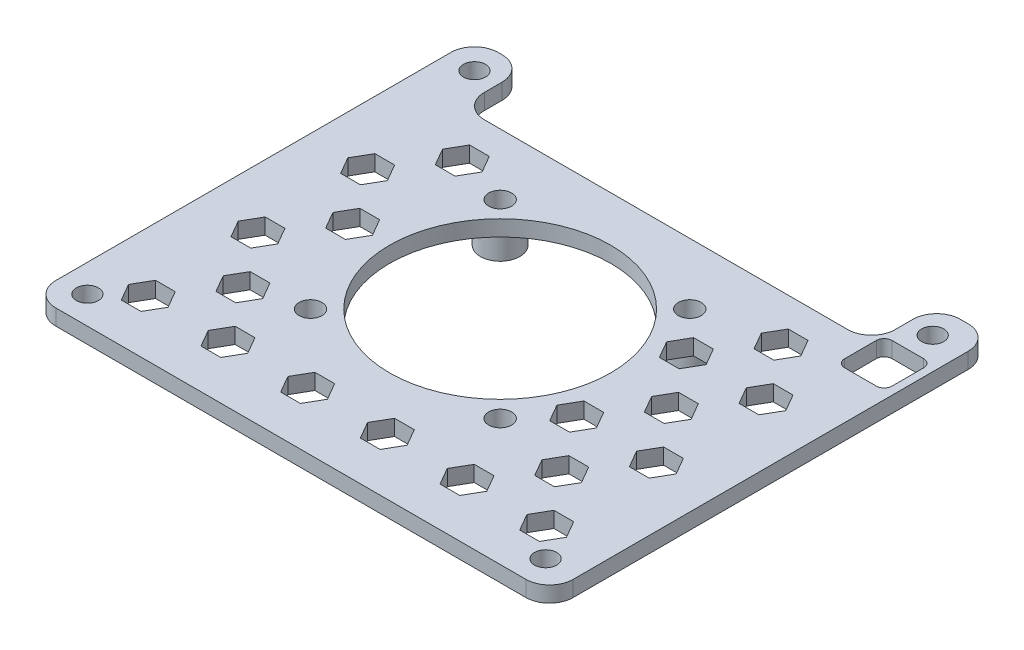
from build123d import *

# Parameters (mm, degrees)
SKETCH_1_R      = 1.4
SKETCH_1_R_2    = 14
SKETCH_1_R_3    = 2.5
EXTRUDE_1_DEPTH = 2
SKETCH_1_4_R    = 2.5
SKETCH_1_4_R_2  = 1.45
EXTRUDE_2_DEPTH = 5
OTHER_START     = -2
OTHER_1_DEPTH   = 2


# Read off the part's stored shape, not the designer's step: 填充阵列1
with BuildPart() as part:
    # 草图1 → 凸台-拉伸1 (new body)
    with BuildSketch(Plane(origin=(0, 0, 0), x_dir=(1, 0, 0), z_dir=(0, 1, 0))):
        with BuildLine():
            Line((-42.5, 25), (-42.5, -25))
            ThreePointArc((-42.5, -25), (-41.621320344, -27.121320344), (-39.5, -28))
            Line((-39.5, -28), (20, -28))
            ThreePointArc((20, -28), (22.121320344, -27.121320344), (23, -25))
            Line((23, -25), (23, 25))
            ThreePointArc((23, 25), (22.121320344, 27.121320344), (20, 28))
            Line((20, 28), (19, 28))
            ThreePointArc((19, 28), (16.878679656, 27.121320344), (16, 25))
            Line((16, 25), (16, 22.75))
            ThreePointArc((16, 22.75), (15.121320344, 20.628679656), (13, 19.75))
            Line((13, 19.75), (-33, 19.75))
            ThreePointArc((-33, 19.75), (-35.121320344, 20.628679656), (-36, 22.75))
            Line((-36, 22.75), (-36, 25))
            ThreePointArc((-36, 25), (-36.878679656, 27.121320344), (-39, 28))
            Line((-39, 28), (-39.5, 28))
            ThreePointArc((-39.5, 28), (-41.621320344, 27.121320344), (-42.5, 25))
        make_face()
        with Locations(Location((-39, 24.5, 0), (0, 0, 270))):
            Circle(SKETCH_1_R, mode=Mode.SUBTRACT)
        with Locations(Location((-39, -24.5, 0), (0, 0, 270))):
            Circle(SKETCH_1_R, mode=Mode.SUBTRACT)
        with Locations(Location((19, 24.5, 0), (0, 0, 270))):
            Circle(SKETCH_1_R, mode=Mode.SUBTRACT)
        with Locations(Location((19, -24.5, 0), (0, 0, 270))):
            Circle(SKETCH_1_R, mode=Mode.SUBTRACT)
        with Locations(Location((-11.25, 0, 0), (0, 0, 270))):
            Circle(SKETCH_1_R_2, mode=Mode.SUBTRACT)
        with Locations(Location((-23.25, 12, 0), (0, 0, 270))):
            Circle(SKETCH_1_R_3, mode=Mode.SUBTRACT)
        with Locations(Location((-23.25, -12, 0), (0, 0, 270))):
            Circle(SKETCH_1_R_3, mode=Mode.SUBTRACT)
        with Locations(Location((0.75, -12, 0), (0, 0, 270))):
            Circle(SKETCH_1_R_3, mode=Mode.SUBTRACT)
        with Locations(Location((0.75, 12, 0), (0, 0, 270))):
            Circle(SKETCH_1_R_3, mode=Mode.SUBTRACT)
        with BuildLine():
            Line((17, 15.36), (21, 15.36))
            ThreePointArc((21, 15.36), (21.707106781, 15.652893219), (22, 16.36))
            Line((22, 16.36), (22, 20.36))
            ThreePointArc((22, 20.36), (21.707106781, 21.067106781), (21, 21.36))
            Line((21, 21.36), (17, 21.36))
            ThreePointArc((17, 21.36), (16.292893219, 21.067106781), (16, 20.36))
            Line((16, 20.36), (16, 16.36))
            ThreePointArc((16, 16.36), (16.292893219, 15.652893219), (17, 15.36))
        make_face(mode=Mode.SUBTRACT)
    extrude(amount=-EXTRUDE_1_DEPTH)

    # 草图1<4> → 凸台-拉伸2 (add)
    # profile 1 of 4: a face of its own
    with BuildSketch(Plane(origin=(0, 0, 0), x_dir=(1, 0, 0), z_dir=(0, 1, 0))):
        with Locations(Location((-23.25, 12, 0), (0, 0, 270))):
            Circle(SKETCH_1_4_R)
        with Locations(Location((-23.25, 12, 0), (0, 0, 270))):
            Circle(SKETCH_1_4_R_2, mode=Mode.SUBTRACT)
    # profile 2 of 4: a face of its own
    with BuildSketch(Plane(origin=(0, 0, 0), x_dir=(1, 0, 0), z_dir=(0, 1, 0))):
        with Locations(Location((0.75, 12, 0), (0, 0, 270))):
            Circle(SKETCH_1_4_R)
        with Locations(Location((0.75, 12, 0), (0, 0, 270))):
            Circle(SKETCH_1_4_R_2, mode=Mode.SUBTRACT)
    # profile 3 of 4: a face of its own
    with BuildSketch(Plane(origin=(0, 0, 0), x_dir=(1, 0, 0), z_dir=(0, 1, 0))):
        with Locations(Location((0.75, -12, 0), (0, 0, 270))):
            Circle(SKETCH_1_4_R)
        with Locations(Location((0.75, -12, 0), (0, 0, 270))):
            Circle(SKETCH_1_4_R_2, mode=Mode.SUBTRACT)
    # profile 4 of 4: a face of its own
    with BuildSketch(Plane(origin=(0, 0, 0), x_dir=(1, 0, 0), z_dir=(0, 1, 0))):
        with Locations(Location((-23.25, -12, 0), (0, 0, 270))):
            Circle(SKETCH_1_4_R)
        with Locations(Location((-23.25, -12, 0), (0, 0, 270))):
            Circle(SKETCH_1_4_R_2, mode=Mode.SUBTRACT)
    extrude(amount=-EXTRUDE_2_DEPTH)

    # 填充阵列1 outline → 填充阵列1 (cut)
    with BuildSketch(Plane(origin=(0, 0, 0), x_dir=(1, 0, 0), z_dir=(0, 1, 0)).offset(OTHER_START)):
        Polygon((-32.464891196, 6.941064074), (-33.714891196, 9.106127583), (-36.214891196, 9.106127583), (-37.464891196, 6.941064074), (-36.214891196, 4.776000564), (-33.714891196, 4.776000564), align=None)
        Polygon((16.714891196, 9.106127583), (14.214891196, 9.106127583), (12.964891196, 6.941064074), (14.214891196, 4.776000564), (16.714891196, 4.776000564), (17.964891196, 6.941064074), align=None)
        Polygon((6.628934718, 9.106127583), (4.128934718, 9.106127583), (2.878934718, 6.941064074), (4.128934718, 4.776000564), (6.628934718, 4.776000564), (7.878934718, 6.941064074), align=None)
        Polygon((-2.207021761, -20.823192222), (-3.457021761, -18.658128712), (-5.957021761, -18.658128712), (-7.207021761, -20.823192222), (-5.957021761, -22.988255731), (-3.457021761, -22.988255731), align=None)
        Polygon((6.628934718, -18.658128712), (4.128934718, -18.658128712), (2.878934718, -20.823192222), (4.128934718, -22.988255731), (6.628934718, -22.988255731), (7.878934718, -20.823192222), align=None)
        Polygon((16.714891196, -18.658128712), (14.214891196, -18.658128712), (12.964891196, -20.823192222), (14.214891196, -22.988255731), (16.714891196, -22.988255731), (17.964891196, -20.823192222), align=None)
        Polygon((-13.542978239, -18.658128712), (-16.042978239, -18.658128712), (-17.292978239, -20.823192222), (-16.042978239, -22.988255731), (-13.542978239, -22.988255731), (-12.292978239, -20.823192222), align=None)
        Polygon((-23.628934718, -18.658128712), (-26.128934718, -18.658128712), (-27.378934718, -20.823192222), (-26.128934718, -22.988255731), (-23.628934718, -22.988255731), (-22.378934718, -20.823192222), align=None)
        Polygon((-33.714891196, -18.658128712), (-36.214891196, -18.658128712), (-37.464891196, -20.823192222), (-36.214891196, -22.988255731), (-33.714891196, -22.988255731), (-32.464891196, -20.823192222), align=None)
        Polygon((-27.421912957, 13.882128148), (-28.671912957, 16.047191657), (-31.171912957, 16.047191657), (-32.421912957, 13.882128148), (-31.171912957, 11.717064638), (-28.671912957, 11.717064638), align=None)
        Polygon((11.671912957, 16.047191657), (9.171912957, 16.047191657), (7.921912957, 13.882128148), (9.171912957, 11.717064638), (11.671912957, 11.717064638), (12.921912957, 13.882128148), align=None)
        Polygon((-32.464891196, -6.941064074), (-33.714891196, -4.776000564), (-36.214891196, -4.776000564), (-37.464891196, -6.941064074), (-36.214891196, -9.106127583), (-33.714891196, -9.106127583), align=None)
        Polygon((6.628934718, -4.776000564), (4.128934718, -4.776000564), (2.878934718, -6.941064074), (4.128934718, -9.106127583), (6.628934718, -9.106127583), (7.878934718, -6.941064074), align=None)
        Polygon((16.714891196, -4.776000564), (14.214891196, -4.776000564), (12.964891196, -6.941064074), (14.214891196, -9.106127583), (16.714891196, -9.106127583), (17.964891196, -6.941064074), align=None)
        Polygon((-27.421912957, 0), (-28.671912957, 2.165063509), (-31.171912957, 2.165063509), (-32.421912957, 0), (-31.171912957, -2.165063509), (-28.671912957, -2.165063509), align=None)
        Polygon((11.671912957, 2.165063509), (9.171912957, 2.165063509), (7.921912957, 0), (9.171912957, -2.165063509), (11.671912957, -2.165063509), (12.921912957, 0), align=None)
        Polygon((-27.421912957, -13.882128148), (-28.671912957, -11.717064638), (-31.171912957, -11.717064638), (-32.421912957, -13.882128148), (-31.171912957, -16.047191657), (-28.671912957, -16.047191657), align=None)
        Polygon((11.671912957, -11.717064638), (9.171912957, -11.717064638), (7.921912957, -13.882128148), (9.171912957, -16.047191657), (11.671912957, -16.047191657), (12.921912957, -13.882128148), align=None)
    extrude(amount=OTHER_1_DEPTH, mode=Mode.SUBTRACT)


solid = part.part
